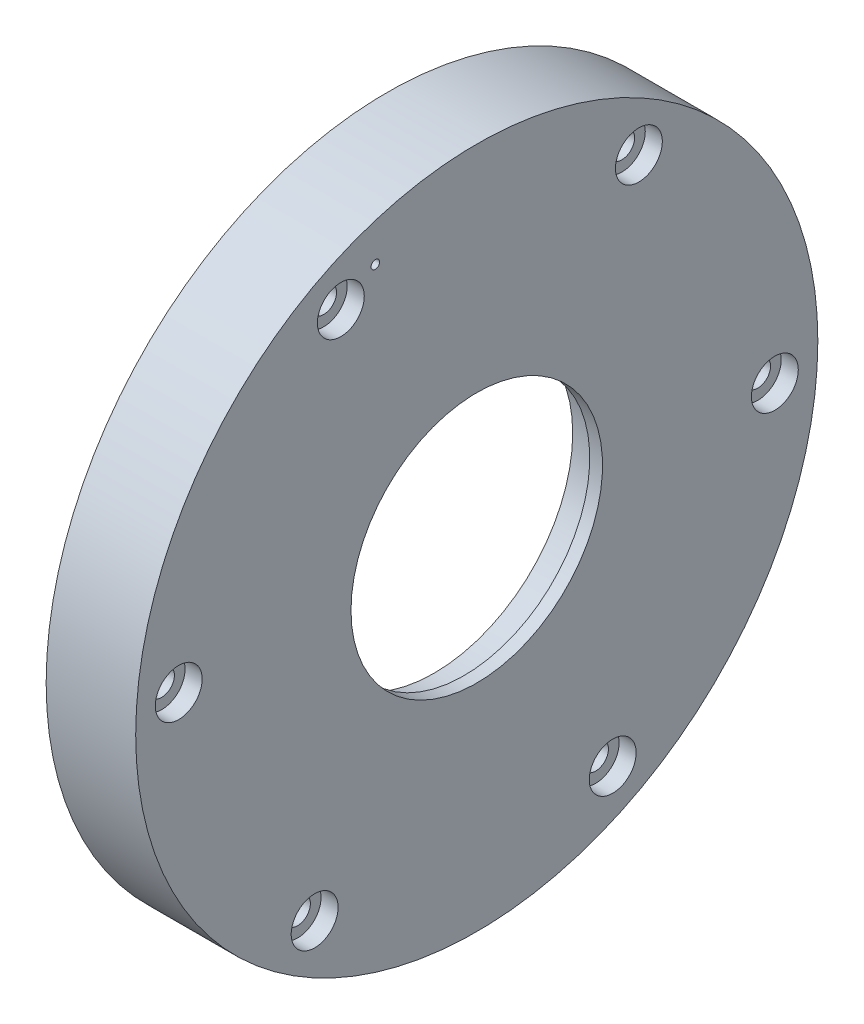
from build123d import *

# Parameters (mm, degrees)
SKETCH3_R          = 2.5
CUT_EXTRUDE1_DEPTH = 4
SKETCH4_R          = 5.5
CUT_EXTRUDE2_DEPTH = 4
SKETCH5_R          = 3
CUT_EXTRUDE3_DEPTH = 116.06954419
SKETCH8_R          = 1
CUT_EXTRUDE6_DEPTH = 2


with BuildPart() as part:
    # Sketch2 → Revolve1 (revolve)
    with BuildSketch(Plane.XY):
        Polygon((0, 80), (0, 52.5), (11, 52.5), (11, 32.5), (18, 32.5), (18, 29.5), (21, 29.5), (21, 80), align=None)
    revolve(axis=Axis((0, 0, 0), (1, 0, 0)))

    # Sketch3 → Cut-Extrude1 (cut)
    with BuildSketch(Plane.ZY):
        with Locations((0, 60)):
            Circle(SKETCH3_R)
        with Locations((12.077911205, 58.771796475)):
            Circle(SKETCH3_R)
        with Locations((23.661351307, 55.137468697)):
            Circle(SKETCH3_R)
        with Locations((34.276092906, 49.245806472)):
            Circle(SKETCH3_R)
        with Locations((43.487567234, 41.338015145)):
            Circle(SKETCH3_R)
        with Locations((50.91865545, 31.73784062)):
            Circle(SKETCH3_R)
        with Locations((56.265127929, 20.838315171)):
            Circle(SKETCH3_R)
        with Locations((59.30809946, 9.08566665)):
            Circle(SKETCH3_R)
        with Locations((59.92299043, -3.03895013)):
            Circle(SKETCH3_R)
        with Locations((58.084627132, -15.039151936)):
            Circle(SKETCH3_R)
        with Locations((53.868272374, -26.423649093)):
            Circle(SKETCH3_R)
        with Locations((47.446544216, -36.726358953)):
            Circle(SKETCH3_R)
        with Locations((39.082348963, -45.525487362)):
            Circle(SKETCH3_R)
        with Locations((29.118117752, -52.460796969)):
            Circle(SKETCH3_R)
        with Locations((17.961787378, -57.248355384)):
            Circle(SKETCH3_R)
        with Locations((6.070099319, -59.692159404)):
            Circle(SKETCH3_R)
        with Locations((-6.070099319, -59.692159404)):
            Circle(SKETCH3_R)
        with Locations((-17.961787378, -57.248355384)):
            Circle(SKETCH3_R)
        with Locations((-29.118117752, -52.460796969)):
            Circle(SKETCH3_R)
        with Locations((-39.082348963, -45.525487362)):
            Circle(SKETCH3_R)
        with Locations((-47.446544216, -36.726358953)):
            Circle(SKETCH3_R)
        with Locations((-53.868272374, -26.423649093)):
            Circle(SKETCH3_R)
        with Locations((-58.084627132, -15.039151936)):
            Circle(SKETCH3_R)
        with Locations((-59.92299043, -3.03895013)):
            Circle(SKETCH3_R)
        with Locations((-59.30809946, 9.08566665)):
            Circle(SKETCH3_R)
        with Locations((-56.265127929, 20.838315171)):
            Circle(SKETCH3_R)
        with Locations((-50.91865545, 31.73784062)):
            Circle(SKETCH3_R)
        with Locations((-43.487567234, 41.338015145)):
            Circle(SKETCH3_R)
        with Locations((-34.276092906, 49.245806472)):
            Circle(SKETCH3_R)
        with Locations((-23.661351307, 55.137468697)):
            Circle(SKETCH3_R)
        with Locations((-12.077911205, 58.771796475)):
            Circle(SKETCH3_R)
    extrude(amount=-CUT_EXTRUDE1_DEPTH, mode=Mode.SUBTRACT)

    # Sketch4 → Cut-Extrude2 (cut)
    with BuildSketch(Plane(origin=(21, 0, 0), x_dir=(0, 0, -1), z_dir=(1, 0, 0))):
        with Locations((-38.025520434, -58.771249738)):
            Circle(SKETCH4_R)
        with Locations((-69.910155502, 3.545441819)):
            Circle(SKETCH4_R)
        with Locations((-31.884635068, 62.316691557)):
            Circle(SKETCH4_R)
        with Locations((38.025520434, 58.771249738)):
            Circle(SKETCH4_R)
        with Locations((69.910155502, -3.545441819)):
            Circle(SKETCH4_R)
        with Locations((31.884635068, -62.316691557)):
            Circle(SKETCH4_R)
    extrude(amount=-CUT_EXTRUDE2_DEPTH, mode=Mode.SUBTRACT)

    # Sketch5 → Cut-Extrude3 (cut, through all)
    with BuildSketch(Plane(origin=(21, 0, 0), x_dir=(0, 0, -1), z_dir=(1, 0, 0))):
        with Locations((-38.025520434, -58.771249738)):
            Circle(SKETCH5_R)
        with Locations((-69.910155502, 3.545441819)):
            Circle(SKETCH5_R)
        with Locations((-31.884635068, 62.316691557)):
            Circle(SKETCH5_R)
        with Locations((38.025520434, 58.771249738)):
            Circle(SKETCH5_R)
        with Locations((69.910155502, -3.545441819)):
            Circle(SKETCH5_R)
        with Locations((31.884635068, -62.316691557)):
            Circle(SKETCH5_R)
    extrude(amount=-CUT_EXTRUDE3_DEPTH, mode=Mode.SUBTRACT)

    # Sketch8 → Cut-Extrude6 (cut)
    with BuildSketch(Plane(origin=(21, 0, 0), x_dir=(0, 0, -1), z_dir=(1, 0, 0))):
        with Locations((-23.796606953, 67.435072873)):
            Circle(SKETCH8_R)
    extrude(amount=-CUT_EXTRUDE6_DEPTH, mode=Mode.SUBTRACT)


solid = part.part
